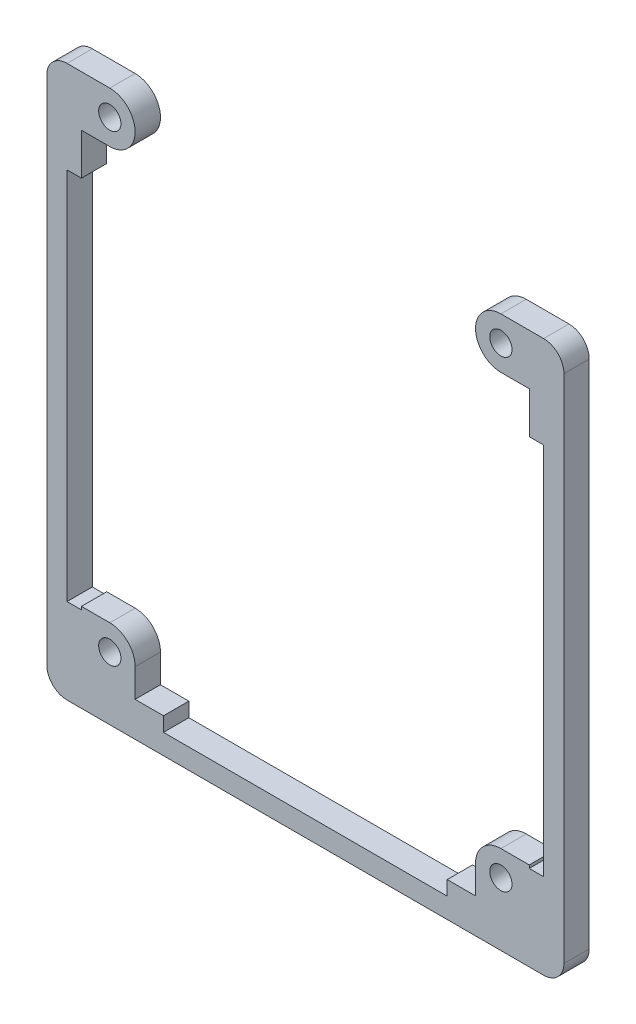
from build123d import *

# Parameters (mm, degrees)
SKETCH1_R           = 1.397
BOSS_EXTRUDE1_DEPTH = 3.175


with BuildPart() as part:
    # Sketch1 → Boss-Extrude1 (new body)
    with BuildSketch(Plane.XY):
        with BuildLine():
            Line((0, 58.42), (0, 53.213))
            Line((0, 53.213), (1.8034, 53.213))
            Line((1.8034, 53.213), (1.8034, 6.35))
            Line((1.8034, 6.35), (0, 6.35))
            Line((0, 6.35), (0, 6.731))
            Line((0, 6.731), (-3.556, 6.731))
            ThreePointArc((-3.556, 6.731), (-5.80106403, 5.80106403), (-6.731, 3.556))
            Line((-6.731, 3.556), (-6.731, 0))
            Line((-6.731, 0), (-10.287, 0))
            Line((-10.287, 0), (-10.287, -1.8034))
            Line((-10.287, -1.8034), (-45.847, -1.8034))
            Line((-45.847, -1.8034), (-45.847, 0))
            Line((-45.847, 0), (-49.403, 0))
            Line((-49.403, 0), (-49.403, 3.556))
            ThreePointArc((-49.403, 3.556), (-50.33293597, 5.80106403), (-52.578, 6.731))
            Line((-52.578, 6.731), (-56.134, 6.731))
            Line((-56.134, 6.731), (-56.134, 6.35))
            Line((-56.134, 6.35), (-57.9374, 6.35))
            Line((-57.9374, 6.35), (-57.9374, 53.213))
            Line((-57.9374, 53.213), (-56.134, 53.213))
            Line((-56.134, 53.213), (-56.134, 58.42))
            Line((-56.134, 58.42), (-52.578, 58.42))
            ThreePointArc((-52.578, 58.42), (-49.403, 61.595), (-52.578, 64.77))
            Line((-52.578, 64.77), (-57.9374, 64.77))
            ThreePointArc((-57.9374, 64.77), (-59.733451224, 64.026051224), (-60.4774, 62.23))
            Line((-60.4774, 62.23), (-60.4774, -1.8034))
            ThreePointArc((-60.4774, -1.8034), (-59.733451224, -3.599451224), (-57.9374, -4.3434))
            Line((-57.9374, -4.3434), (1.8034, -4.3434))
            ThreePointArc((1.8034, -4.3434), (3.599451224, -3.599451224), (4.3434, -1.8034))
            Line((4.3434, -1.8034), (4.3434, 62.23))
            ThreePointArc((4.3434, 62.23), (3.599451224, 64.026051224), (1.8034, 64.77))
            Line((1.8034, 64.77), (-3.556000021, 64.77))
            ThreePointArc((-3.556000021, 64.77), (-6.731, 61.59499999), (-3.556, 58.42))
            Line((-3.556, 58.42), (0, 58.42))
        make_face()
        with Locations((-3.556, 61.595)):
            Circle(SKETCH1_R, mode=Mode.SUBTRACT)
        with Locations((-52.578, 61.595)):
            Circle(SKETCH1_R, mode=Mode.SUBTRACT)
        with Locations((-52.578, 3.556)):
            Circle(SKETCH1_R, mode=Mode.SUBTRACT)
        with Locations((-3.556, 3.556)):
            Circle(SKETCH1_R, mode=Mode.SUBTRACT)
    extrude(amount=BOSS_EXTRUDE1_DEPTH)


solid = part.part
